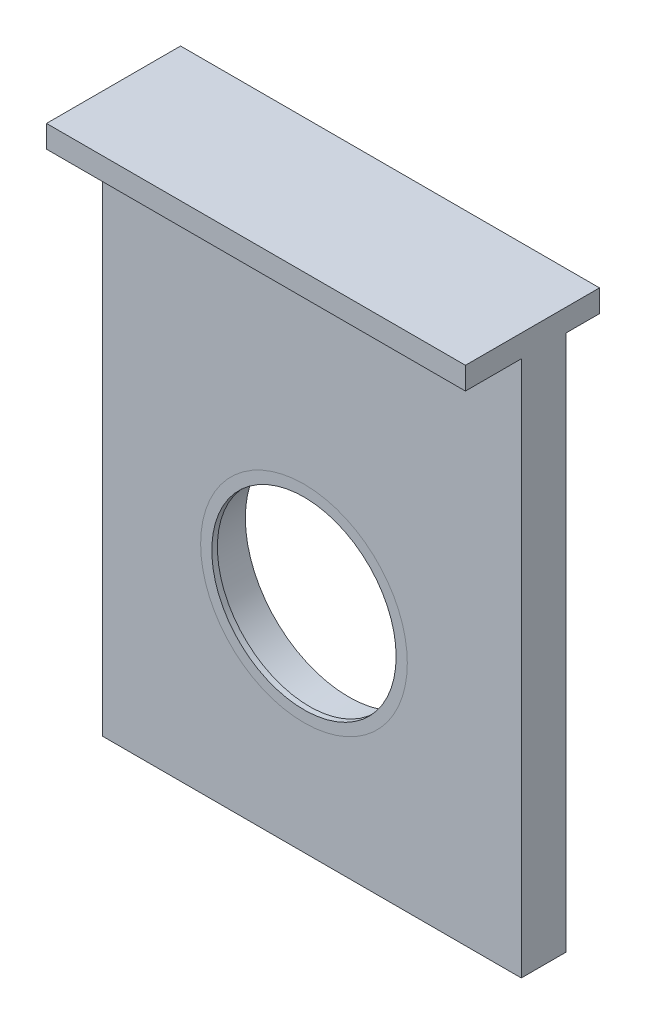
from build123d import *

# Parameters (mm, degrees)
SKETCH12_W                = 75
SKETCH12_H                = 100
BOSS_EXTRUDE10_DEPTH      = 8
BOSS_EXTRUDE13_DEPTH      = 10
BOSS_EXTRUDE13_DEPTH_BACK = 14
SKETCH24_W                = 75
SKETCH24_H                = 4
SKETCH25_R                = 18.5
CUT_EXTRUDE1_DEPTH        = 171.292391386
SKETCH26_R                = 18.5
SKETCH26_R_2              = 16.5
BOSS_EXTRUDE15_DEPTH      = 1


with BuildPart() as part:
    # Sketch12 → Boss-Extrude10 (new body)
    with BuildSketch(Plane.XY):
        with Locations((99.625849364, 50)):
            Rectangle(SKETCH12_W, SKETCH12_H)
    extrude(amount=BOSS_EXTRUDE10_DEPTH)

    # Sketch24 → Boss-Extrude13 (add, two sides: drawn at the far end of the back side and taken through both)
    with BuildSketch(Plane.XY.offset(8).offset(-BOSS_EXTRUDE13_DEPTH_BACK)):
        with Locations((99.625849364, 98)):
            Rectangle(SKETCH24_W, SKETCH24_H)
    extrude(amount=BOSS_EXTRUDE13_DEPTH + BOSS_EXTRUDE13_DEPTH_BACK)

    # Sketch25 → Cut-Extrude1 (cut, through all)
    with BuildSketch(Plane.XY.offset(8)):
        with Locations((98.219620603, 38.627603634)):
            Circle(SKETCH25_R)
    extrude(amount=-CUT_EXTRUDE1_DEPTH, mode=Mode.SUBTRACT)


with BuildPart() as body_2:
    # Sketch26 → Boss-Extrude15 (new body)
    with BuildSketch(Plane.XY.offset(8)):
        with Locations((98.219620603, 38.627603634)):
            Circle(SKETCH26_R)
        with Locations((98.219620603, 38.627603634)):
            Circle(SKETCH26_R_2, mode=Mode.SUBTRACT)
    extrude(amount=-BOSS_EXTRUDE15_DEPTH)


solid = Compound([part.part, body_2.part])
